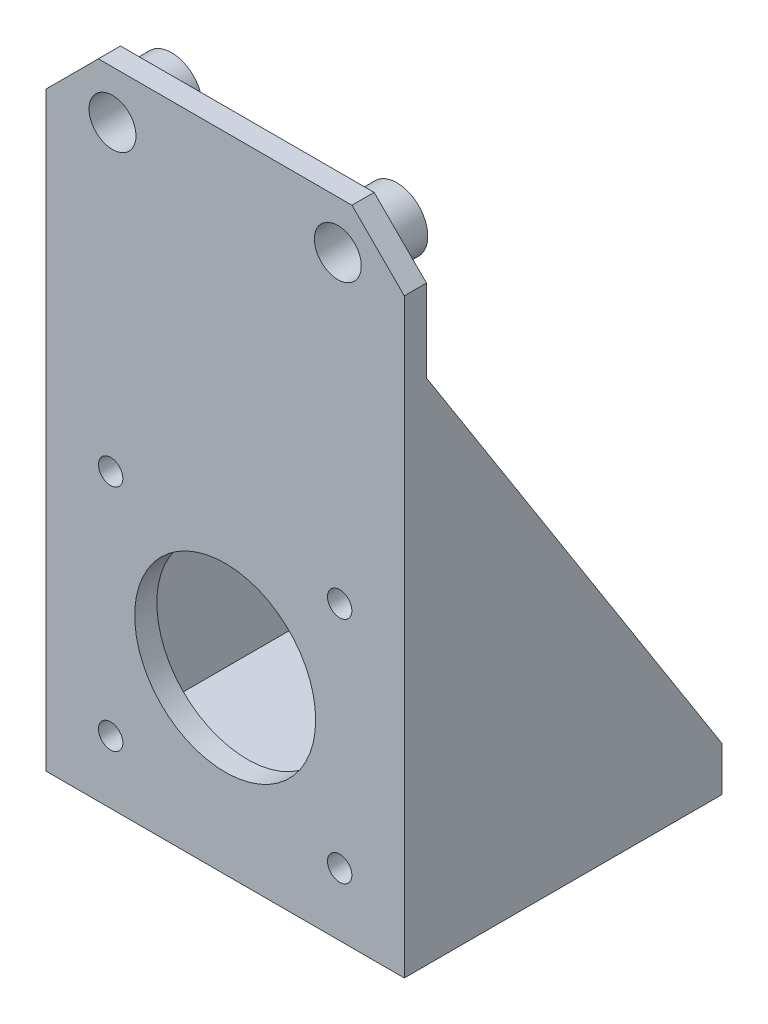
from build123d import *
from build123d.topology import SkipClean

# Parameters (mm, degrees)
SKETCH1_R                = 1.65
SKETCH1_R_2              = 12.25
SKETCH1_R_3              = 3.175
BOSS_EXTRUDE1_DEPTH      = 3
BOSS_EXTRUDE2_START      = 3
SKETCH2_R                = 4.175
SKETCH2_R_2              = 3.175
BOSS_EXTRUDE2_DEPTH      = 3
BOSS_EXTRUDE3_START      = 2
SKETCH3_R                = 4.175
BOSS_EXTRUDE3_DEPTH      = 2
BOSS_EXTRUDE4_DEPTH      = 40
BOSS_EXTRUDE4_DEPTH_BACK = 3
SKETCH5_W                = 3
SKETCH5_H                = 5
BOSS_EXTRUDE5_DEPTH      = 3
BOSS_EXTRUDE7_DEPTH      = 3
BOSS_EXTRUDE9_DEPTH      = 3
SKETCH9_W                = 3
SKETCH9_H                = 75.55
BOSS_EXTRUDE10_DEPTH     = 3
CHAMFER1_SIZE            = 3
BOSS_EXTRUDE12_DEPTH     = 3
BOSS_EXTRUDE13_DEPTH     = 3
BOSS_EXTRUDE14_DEPTH     = 3


with BuildPart() as part:
    # Sketch1 → Boss-Extrude1 (new body)
    with BuildSketch(Plane.XY):
        Polygon((-33.82227566, -6), (-33.82227566, 36.5), (-33.82227566, 72.55), (-28.82227566, 77.55), (3.67772434, 77.55), (8.67772434, 72.55), (8.67772434, 36.5), (8.67772434, -6), align=None)
        with Locations((2.92772434, 30.5)):
            Circle(SKETCH1_R, mode=Mode.SUBTRACT)
        with Locations(Location((2.92772434, -0.5, 0), (0, 0, 180))):
            Circle(SKETCH1_R, mode=Mode.SUBTRACT)
        with Locations((-28.07227566, -0.5)):
            Circle(SKETCH1_R, mode=Mode.SUBTRACT)
        with Locations(Location((-28.07227566, 30.5, 0), (0, 0, 180))):
            Circle(SKETCH1_R, mode=Mode.SUBTRACT)
        with Locations((-12.57227566, 15.25)):
            Circle(SKETCH1_R_2, mode=Mode.SUBTRACT)
        with Locations((-27.82227566, 71.55)):
            Circle(SKETCH1_R_3, mode=Mode.SUBTRACT)
        with Locations(Location((2.67772434, 71.55, 0), (0, 0, 180))):
            Circle(SKETCH1_R_3, mode=Mode.SUBTRACT)
    extrude(amount=BOSS_EXTRUDE1_DEPTH)

    # Sketch2 → Boss-Extrude2 (add)
    # profile 1 of 2: a face of its own
    with SkipClean():  # the faces are left unmerged after this step: merging them gives an invalid solid
        with BuildSketch(Plane(origin=(0, 0, 0), x_dir=(-1, 0, 0), z_dir=(0, 0, -1)).offset(BOSS_EXTRUDE2_START)):
            with Locations((-2.67772434, 71.55)):
                Circle(SKETCH2_R)
            with Locations((-2.67772434, 71.55)):
                Circle(SKETCH2_R_2, mode=Mode.SUBTRACT)
        # profile 2 of 2: a face of its own
        with BuildSketch(Plane(origin=(0, 0, 0), x_dir=(-1, 0, 0), z_dir=(0, 0, -1)).offset(BOSS_EXTRUDE2_START)):
            with Locations((27.82227566, 71.55)):
                Circle(SKETCH2_R)
            with Locations((27.82227566, 71.55)):
                Circle(SKETCH2_R_2, mode=Mode.SUBTRACT)
        extrude(amount=-BOSS_EXTRUDE2_DEPTH)

    # Sketch3 → Boss-Extrude3 (add)
    with SkipClean():  # the faces are left unmerged after this step: merging them gives an invalid solid
        with BuildSketch(Plane(origin=(0, 0, -3), x_dir=(-1, 0, 0), z_dir=(0, 0, -1)).offset(BOSS_EXTRUDE3_START)):
            with Locations((-2.67772434, 71.55)):
                Circle(SKETCH3_R)
            with Locations((27.82227566, 71.55)):
                Circle(SKETCH3_R)
        extrude(amount=-BOSS_EXTRUDE3_DEPTH)

    # Sketch5 → Boss-Extrude5 (add)
    with SkipClean():  # the faces are left unmerged after this step: merging them gives an invalid solid
        with BuildSketch(Plane.XY.offset(3)):
            with Locations((10.17772434, 45.531399611)):
                Rectangle(SKETCH5_W, SKETCH5_H)
            with Locations((-35.32227566, 45.531399611)):
                Rectangle(SKETCH5_W, SKETCH5_H)
        extrude(amount=-BOSS_EXTRUDE5_DEPTH)



with BuildPart() as body_2:
    # Sketch4 → Boss-Extrude4 (new, two sides: drawn at the far end of the back side and taken through both)
    with BuildSketch(Plane(origin=(0, 0, 0), x_dir=(-1, 0, 0), z_dir=(0, 0, -1)).offset(-BOSS_EXTRUDE4_DEPTH_BACK)):
        Polygon((33.82227566, -6), (-8.67772434, -6), (-8.67772434, -3), (-11.67772434, -3), (-11.67772434, -9), (-9.078713654, -9), (33.421286346, -9), (36.82227566, -9), (36.82227566, -3), (33.82227566, -3), align=None)
    extrude(amount=BOSS_EXTRUDE4_DEPTH + BOSS_EXTRUDE4_DEPTH_BACK)


with BuildPart() as part_1:
    with SkipClean():  # the faces are left unmerged after this step: merging them gives an invalid solid
        add(part.part)

        add(body_2.part)  # Boss-Extrude7 merges body 2
        # Sketch6 → Boss-Extrude7 (add)
        with BuildSketch(Plane(origin=(8.67772434, 0, 0), x_dir=(0, 0, -1), z_dir=(1, 0, 0))):
            Polygon((0, 48.031399611), (40, -3), (36.080844313, -3), (0, 43.031399611), align=None)
        extrude(amount=BOSS_EXTRUDE7_DEPTH)

    # Sketch8 → Boss-Extrude9 (add)
    with SkipClean():  # the faces are left unmerged after this step: merging them gives an invalid solid
        with BuildSketch(Plane.ZY.offset(36.82227566)):
            Polygon((0, 48.031399611), (0, 43.031399611), (-36.080844313, -3), (-40, -3), align=None)
        extrude(amount=-BOSS_EXTRUDE9_DEPTH)

    # Sketch9 → Boss-Extrude10 (add)
    with SkipClean():  # the faces are left unmerged after this step: merging them gives an invalid solid
        with BuildSketch(Plane.XY.offset(3)):
            with Locations((-35.32227566, 34.775)):
                Rectangle(SKETCH9_W, SKETCH9_H)
            with Locations((10.17772434, 34.775)):
                Rectangle(SKETCH9_W, SKETCH9_H)
        extrude(amount=-BOSS_EXTRUDE10_DEPTH)

    # Chamfer1
    chamfer1_edges = [part_1.edges().sort_by_distance(p)[0] for p in [
        (11.67772434, 72.55, 1.5),
        (-36.82227566, 72.55, 1.5),
    ]]
    chamfer(chamfer1_edges, length=CHAMFER1_SIZE - 0.0001)  # a hair under: the kernel refuses the full size

    # Sketch10 → Boss-Extrude12 (add)
    with BuildSketch(Plane(origin=(11.67772434, 0, 0), x_dir=(0, 0, -1), z_dir=(1, 0, 0))):
        Polygon((-3, 64.55), (-3, -9), (40, -9), (40, -3), align=None)
    extrude(amount=-BOSS_EXTRUDE12_DEPTH)

    # Sketch11 → Boss-Extrude13 (add)
    with BuildSketch(Plane.ZY.offset(36.82227566)):
        Polygon((3, -9), (3, 64.55), (-40, -3), (-40, -9), align=None)
    extrude(amount=-BOSS_EXTRUDE13_DEPTH)

    # Sketch12 → Boss-Extrude14 (add)
    with BuildSketch(Plane.XY.offset(3)):
        Polygon((-36.82227566, 70.964213562), (-36.82227566, 69.55), (-33.82227566, 72.55), (-28.82227566, 77.55), (-12.57227566, 77.55), (-12.57227566, 78.05), (-29.736489222, 78.05), align=None)
        Polygon((4.591937902, 78.05), (-12.57227566, 78.05), (-12.57227566, 77.55), (3.67772434, 77.55), (8.67772434, 72.55), (11.67772434, 69.55), (11.67772434, 70.964213562), align=None)
    extrude(amount=-BOSS_EXTRUDE14_DEPTH)


solid = part_1.part
